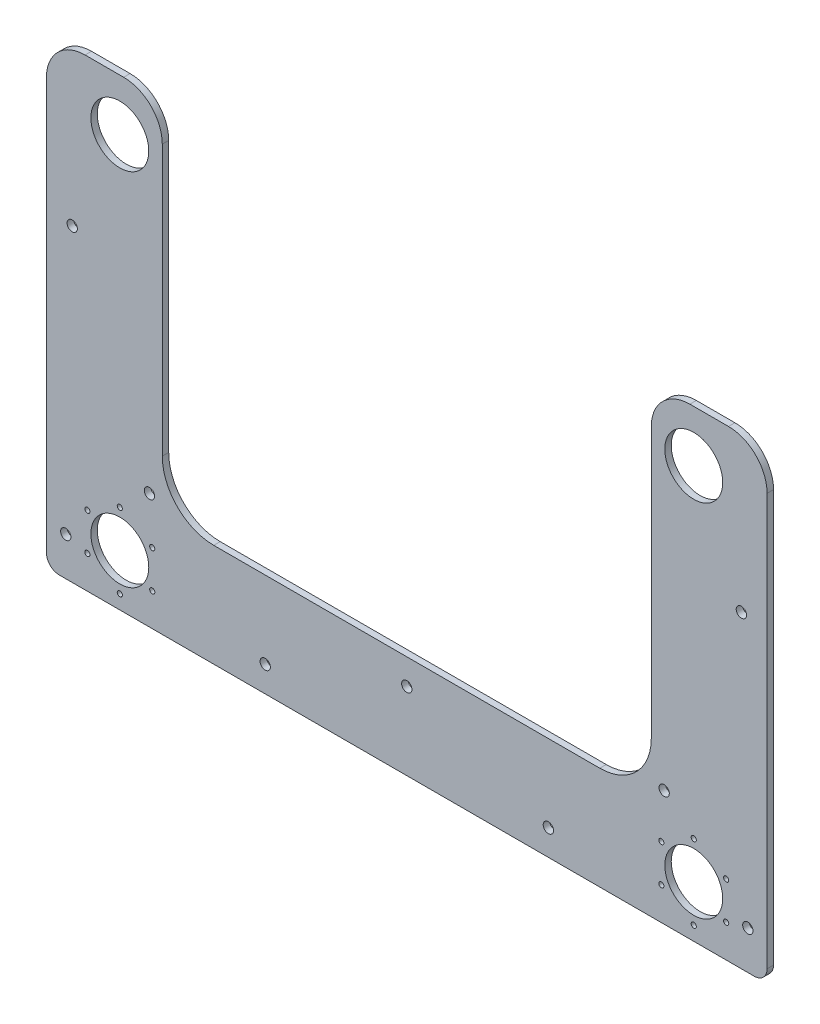
from build123d import *

# Parameters (mm, degrees)
SKETCH1_R           = 14.2875
SKETCH1_R_2         = 1.27
SKETCH1_R_3         = 2.54
BOSS_EXTRUDE3_DEPTH = 3.175
SKETCH2_W           = 355.6
SKETCH2_H           = 19.05
CUT_EXTRUDE1_DEPTH  = 290.621961572
FILLET1_R           = 19.05


with BuildPart() as part:
    # Sketch1 → Boss-Extrude3 (new body)
    with BuildSketch(Plane.XY):
        with BuildLine():
            Line((120.65, -152.4), (120.65, -6.35))
            Line((120.65, -6.35), (120.65, 6.35))
            ThreePointArc((120.65, 6.35), (124.369743879, 15.330256121), (133.35, 19.05))
            Line((133.35, 19.05), (165.1, 19.05))
            ThreePointArc((165.1, 19.05), (174.080256121, 15.330256121), (177.8, 6.35))
            Line((177.8, 6.35), (177.8, -6.35))
            Line((177.8, -6.35), (177.8, -222.25))
            ThreePointArc((177.8, -222.25), (175.940128061, -226.740128061), (171.45, -228.6))
            Line((171.45, -228.6), (12.7, -228.6))
            Line((12.7, -228.6), (-12.7, -228.6))
            Line((-12.7, -228.6), (-171.45, -228.6))
            ThreePointArc((-171.45, -228.6), (-175.940128061, -226.740128061), (-177.8, -222.25))
            Line((-177.8, -222.25), (-177.8, -6.35))
            Line((-177.8, -6.35), (-177.8, 6.35))
            ThreePointArc((-177.8, 6.35), (-174.080256121, 15.330256121), (-165.1, 19.05))
            Line((-165.1, 19.05), (-133.35, 19.05))
            ThreePointArc((-133.35, 19.05), (-124.369743879, 15.330256121), (-120.65, 6.35))
            Line((-120.65, 6.35), (-120.65, -6.35))
            Line((-120.65, -6.35), (-120.65, -152.4))
            ThreePointArc((-120.65, -152.4), (-113.210512242, -170.360512242), (-95.25, -177.8))
            Line((-95.25, -177.8), (-12.7, -177.8))
            Line((-12.7, -177.8), (12.7, -177.8))
            Line((12.7, -177.8), (95.25, -177.8))
            ThreePointArc((95.25, -177.8), (113.210512242, -170.360512242), (120.65, -152.4))
        make_face()
        with Locations((141.605, -25.4)):
            Circle(SKETCH1_R, mode=Mode.SUBTRACT)
        with Locations((-141.605, -25.4)):
            Circle(SKETCH1_R, mode=Mode.SUBTRACT)
        with Locations((-141.605, -203.2)):
            Circle(SKETCH1_R, mode=Mode.SUBTRACT)
        with Locations((-141.605, -184.722481985)):
            Circle(SKETCH1_R_2, mode=Mode.SUBTRACT)
        with Locations((-125.603, -193.961240992)):
            Circle(SKETCH1_R_2, mode=Mode.SUBTRACT)
        with Locations((-125.603, -212.438759008)):
            Circle(SKETCH1_R_2, mode=Mode.SUBTRACT)
        with Locations((-141.605, -221.677518015)):
            Circle(SKETCH1_R_2, mode=Mode.SUBTRACT)
        with Locations((-157.607, -212.438759008)):
            Circle(SKETCH1_R_2, mode=Mode.SUBTRACT)
        with Locations((-157.607, -193.961240992)):
            Circle(SKETCH1_R_2, mode=Mode.SUBTRACT)
        with Locations((157.607, -212.438759008)):
            Circle(SKETCH1_R_2, mode=Mode.SUBTRACT)
        with Locations((157.607, -193.961240992)):
            Circle(SKETCH1_R_2, mode=Mode.SUBTRACT)
        with Locations((141.605, -184.722481985)):
            Circle(SKETCH1_R_2, mode=Mode.SUBTRACT)
        with Locations((125.603, -193.961240992)):
            Circle(SKETCH1_R_2, mode=Mode.SUBTRACT)
        with Locations((125.603, -212.438759008)):
            Circle(SKETCH1_R_2, mode=Mode.SUBTRACT)
        with Locations((141.605, -221.677518015)):
            Circle(SKETCH1_R_2, mode=Mode.SUBTRACT)
        with Locations((141.605, -203.2)):
            Circle(SKETCH1_R, mode=Mode.SUBTRACT)
        with Locations((-69.85, -215.9)):
            Circle(SKETCH1_R_3, mode=Mode.SUBTRACT)
        with Locations((69.85, -215.9)):
            Circle(SKETCH1_R_3, mode=Mode.SUBTRACT)
        with Locations((0, -190.5)):
            Circle(SKETCH1_R_3, mode=Mode.SUBTRACT)
        with Locations((-127, -171.45)):
            Circle(SKETCH1_R_3, mode=Mode.SUBTRACT)
        with Locations((-149.225, 6.35)):
            Circle(SKETCH1_R_3, mode=Mode.SUBTRACT)
        with Locations((127, -171.45)):
            Circle(SKETCH1_R_3, mode=Mode.SUBTRACT)
        with Locations((149.225, 6.35)):
            Circle(SKETCH1_R_3, mode=Mode.SUBTRACT)
        with Locations((-168.275, -209.55)):
            Circle(SKETCH1_R_3, mode=Mode.SUBTRACT)
        with Locations((168.275, -209.55)):
            Circle(SKETCH1_R_3, mode=Mode.SUBTRACT)
        with Locations((-165.1, -76.2)):
            Circle(SKETCH1_R_3, mode=Mode.SUBTRACT)
        with Locations((165.1, -76.2)):
            Circle(SKETCH1_R_3, mode=Mode.SUBTRACT)
    extrude(amount=BOSS_EXTRUDE3_DEPTH)

    # Sketch2 → Cut-Extrude1 (cut, through all)
    with BuildSketch(Plane.XY.offset(3.175)):
        with Locations((0, 9.525)):
            Rectangle(SKETCH2_W, SKETCH2_H)
    extrude(amount=-CUT_EXTRUDE1_DEPTH, mode=Mode.SUBTRACT)

    # Fillet1
    fillet1_edges = [part.edges().sort_by_distance(p)[0] for p in [
        (177.8, 0, 1.5875),
        (120.65, 0, 1.5875),
        (-120.65, 0, 1.5875),
        (-177.8, 0, 1.5875),
    ]]
    fillet(fillet1_edges, radius=FILLET1_R)


solid = part.part
